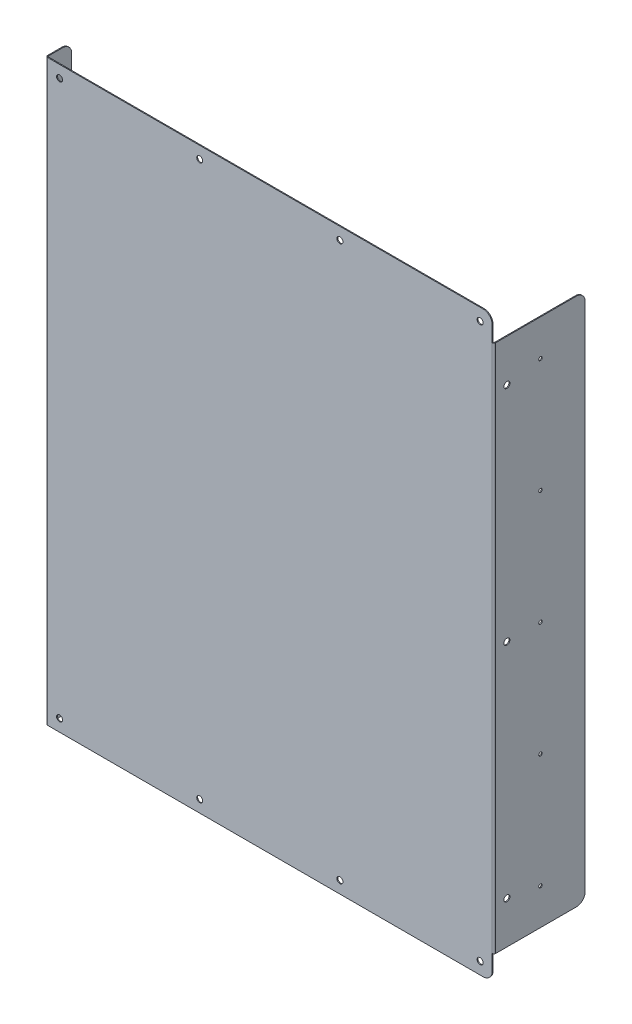
from build123d import *

# Parameters (mm, degrees)
BASE_FLANGE1_DEPTH       = 480
CUT_EXTRUDE1_START       = -3
SKETCH6_W                = 170
SKETCH6_H                = 41
CUT_EXTRUDE1_DEPTH       = 902.017817195
M5_CLEARANCE_HOLE1_D     = 5.8
FILLET1_R                = 15
M8_CLEARANCE_HOLE1_D     = 10
M8_CLEARANCE_HOLE2_D     = 10
M8_CLEARANCE_HOLE2_DEPTH = 8.995696905
M8_CLEARANCE_HOLE2_TIP   = 3.004303095
M8_CLEARANCE_HOLE3_D     = 10
M8_CLEARANCE_HOLE3_DEPTH = 8.995696905
M8_CLEARANCE_HOLE3_TIP   = 3.004303095


# Sheet-metal steps are written as plain solids
with BuildPart() as part:
    # Sketch1 → Base-Flange1 (new, symmetric)
    with BuildSketch(Plane(origin=(0, 0, 0), x_dir=(1, 0, 0), z_dir=(0, 1, 0))):
        with BuildLine():
            Line((-370.5, 40), (-370.5, 1.5))
            ThreePointArc((-370.5, 1.5), (-370.060660172, 0.439339828), (-369, 0))
            Line((-369, 0), (369, 0))
            ThreePointArc((369, 0), (370.060660172, 0.439339828), (370.5, 1.5))
            Line((370.5, 1.5), (370.5, 150))
            Line((370.5, 150), (372, 150))
            Line((372, 150), (372, 1.5))
            ThreePointArc((372, 1.5), (371.121320344, -0.621320344), (369, -1.5))
            Line((369, -1.5), (-369, -1.5))
            ThreePointArc((-369, -1.5), (-371.121320344, -0.621320344), (-372, 1.5))
            Line((-372, 1.5), (-372, 40))
            Line((-372, 40), (-370.5, 40))
        make_face()
    extrude(amount=BASE_FLANGE1_DEPTH, both=True)

    # Sketch6 → Cut-Extrude1 (cut)
    with BuildSketch(Plane(origin=(372, 0, 0), x_dir=(0, 0, -1), z_dir=(1, 0, 0)).offset(CUT_EXTRUDE1_START)):
        with Locations((73.5, 459.5)):
            Rectangle(SKETCH6_W, SKETCH6_H)
    cut_extrude1 = extrude(amount=CUT_EXTRUDE1_DEPTH, mode=Mode.SUBTRACT)

    # Mirror1: Cut-Extrude1 across plane
    add(cut_extrude1.mirror(Plane.ZX), mode=Mode.SUBTRACT)

    # M5 Clearance Hole1 (through all)
    with Locations(Plane(origin=(372, 0, 0), x_dir=(0, 0, -1), z_dir=(1, 0, 0))):
        with Locations((75.75, 379), (75.75, 189.5), (75.75, 0), (75.75, -189.5), (75.75, -379)):
            Hole(M5_CLEARANCE_HOLE1_D / 2)

    # Fillet1
    fillet1_edges = [part.edges().sort_by_distance(p)[0] for p in [
        (-371.25, -480, -40),
        (369, -480, 0.75),
        (369, 480, 0.75),
        (371.25, 439, -150),
        (371.25, -439, -150),
        (-371.25, 480, -40),
    ]]
    fillet(fillet1_edges, radius=FILLET1_R)

    # M8 Clearance Hole1 (through all)
    with Locations(Plane.XY.offset(1.5)):
        with Locations((349, 460), (116.333333333, 460), (-116.333333333, 460), (-349, 460)):
            m8_clearance_hole1 = Hole(M8_CLEARANCE_HOLE1_D / 2)

    # Mirror2: M8 Clearance Hole1 across plane
    add(m8_clearance_hole1.mirror(Plane.ZX), mode=Mode.SUBTRACT)

    # M8 Clearance Hole2
    with Locations(Plane.ZY.offset(372)):
        with Locations((-20, 410), (-20, 136.666666667), (-20, -136.666666667), (-20, -410)):
            Hole(M8_CLEARANCE_HOLE2_D / 2, depth=M8_CLEARANCE_HOLE2_DEPTH)
            with Locations((0, 0, -(M8_CLEARANCE_HOLE2_DEPTH + M8_CLEARANCE_HOLE2_TIP / 2))):  # 118° drill point
                Cone(0, M8_CLEARANCE_HOLE2_D / 2, M8_CLEARANCE_HOLE2_TIP, mode=Mode.SUBTRACT)

    # M8 Clearance Hole3
    with Locations(Plane(origin=(372, 0, 0), x_dir=(0, 0, -1), z_dir=(1, 0, 0))):
        with Locations((20, 369), (20, 0), (20, -369)):
            Hole(M8_CLEARANCE_HOLE3_D / 2, depth=M8_CLEARANCE_HOLE3_DEPTH)
            with Locations((0, 0, -(M8_CLEARANCE_HOLE3_DEPTH + M8_CLEARANCE_HOLE3_TIP / 2))):  # 118° drill point
                Cone(0, M8_CLEARANCE_HOLE3_D / 2, M8_CLEARANCE_HOLE3_TIP, mode=Mode.SUBTRACT)


solid = part.part
